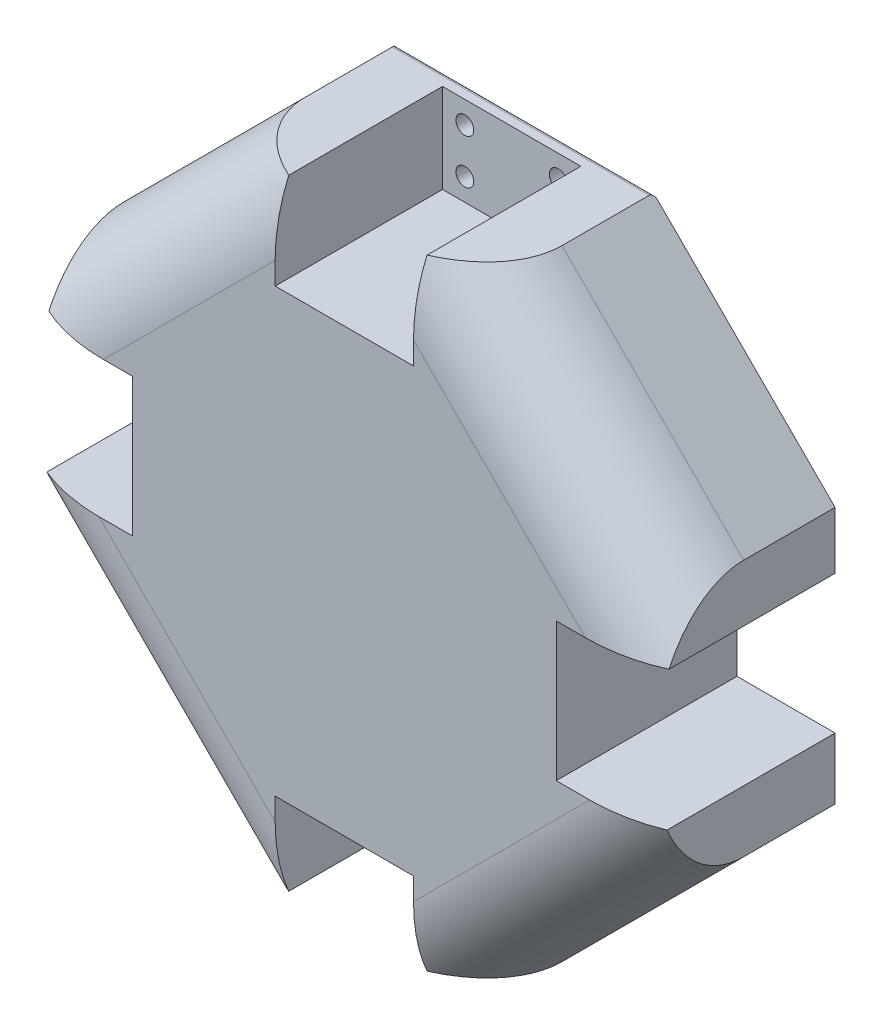
from build123d import *

# Parameters (mm, degrees)
RESSALTO_EXTRUS_O1_DEPTH = 40
CASCA1_T                 = 0.5
ESBO_O2_W                = 31
ESBO_O2_H                = 20
RESSALTO_EXTRUS_O2_DEPTH = 3
FILETE1_R                = 20
FILETE2_R                = 20
ESBO_O3_R                = 2
CORTE_EXTRUS_O1_DEPTH    = 106.198621664
FILETE3_R                = 1
FILETE4_R                = 1


with BuildPart() as part:
    # Esboço1 → Ressalto-extrusão1 (new body)
    with BuildSketch(Plane.XY):
        Polygon((-16.000735804, -69), (-16.000735804, -49), (15.999264196, -49), (15.999264196, -69), (28.580735804, -69), (69, -28.580735804), (69, -15.500735804), (47, -15.500735804), (47, 16.499264196), (69, 16.499264196), (69, 28.580735804), (28.580735804, 69), (15.999264196, 69), (15.999264196, 49), (-16.000735804, 49), (-16.000735804, 69), (-28.580735804, 69), (-69, 28.580735804), (-69, 16.499264196), (-47, 16.499264196), (-47, -15.500735804), (-69, -15.500735804), (-69, -28.580735804), (-28.580735804, -69), align=None)
    extrude(amount=RESSALTO_EXTRUS_O1_DEPTH)

    # Casca1
    casca1_openings = [part.faces().sort_by_distance(p)[0] for p in [
        (7.1958e-05, -0.05370825, 0),
    ]]
    offset(amount=CASCA1_T, openings=casca1_openings, kind=Kind.INTERSECTION)

    # Esboço2 → Ressalto-extrusão2 (add)
    with BuildSketch(Plane.XY):
        with Locations((-0.000735804, -59.5)):
            Rectangle(ESBO_O2_W, ESBO_O2_H)
        with Locations((-0.000735804, 59.5)):
            Rectangle(ESBO_O2_W, ESBO_O2_H)
    extrude(amount=RESSALTO_EXTRUS_O2_DEPTH)

    # Filete1
    filete1_edges = [part.edges().sort_by_distance(p)[0] for p in [
        (-49.143921292, 49.143921292, 40.5),
        (49.143921292, -49.143921292, 40.5),
        (-49.143921292, -49.143921292, 40.5),
        (49.143921292, 49.143921292, 40.5),
    ]]
    fillet(filete1_edges, radius=FILETE1_R)

    # Filete2
    filete2_edges = [part.edges().sort_by_distance(p)[0] for p in [
        (-48.790367902, 48.790367902, 40),
        (-48.790367902, -48.790367902, 40),
        (48.790367902, -48.790367902, 40),
        (48.790367902, 48.790367902, 40),
    ]]
    fillet(filete2_edges, radius=FILETE2_R)

    # Esboço3 → Corte-extrusão1 (cut, through all)
    with BuildSketch(Plane.XY.offset(3)):
        with Locations((-10.500735804, -54.5)):
            Circle(ESBO_O3_R)
        with Locations((-10.500735804, -64.5)):
            Circle(ESBO_O3_R)
        with Locations((10.439264196, -64.5)):
            Circle(ESBO_O3_R)
        with Locations((10.439264196, -54.5)):
            Circle(ESBO_O3_R)
        with Locations(Location((10.439264196, 54.5, 0), (0, 0, 180))):
            Circle(ESBO_O3_R)
        with Locations(Location((10.439264196, 64.5, 0), (0, 0, 180))):
            Circle(ESBO_O3_R)
        with Locations(Location((-10.500735804, 64.5, 0), (0, 0, 180))):
            Circle(ESBO_O3_R)
        with Locations(Location((-10.500735804, 54.5, 0), (0, 0, 180))):
            Circle(ESBO_O3_R)
    extrude(amount=-CORTE_EXTRUS_O1_DEPTH, mode=Mode.SUBTRACT)

    # Filete3
    # the kernel refuses this fillet: 1 mm, written as the material it takes off along each edge
    with BuildSketch(Plane(origin=(31.287842585, -69.5, 0), x_dir=(0, 1, 0), z_dir=(-1, 0, 0))) as filete3_piece_1:
        with BuildLine():
            CenterArc((FILETE3_R, -FILETE3_R), FILETE3_R, 90, 90)
            Line((0, -FILETE3_R), (0, 0))
            Line((0, 0), (FILETE3_R, 0))
        make_face()
    extrude(amount=62.57568517, mode=Mode.SUBTRACT)

    # Filete4
    # the kernel refuses this fillet: 1 mm, written as the material it takes off along each edge
    with BuildSketch(Plane(origin=(-31.287842585, 69.5, 0), x_dir=(0, -1, 0), z_dir=(1, 0, 0))) as filete4_piece_1:
        with BuildLine():
            CenterArc((FILETE4_R, -FILETE4_R), FILETE4_R, 90, 90)
            Line((0, -FILETE4_R), (0, 0))
            Line((0, 0), (FILETE4_R, 0))
        make_face()
    extrude(amount=62.57568517, mode=Mode.SUBTRACT)


solid = part.part
